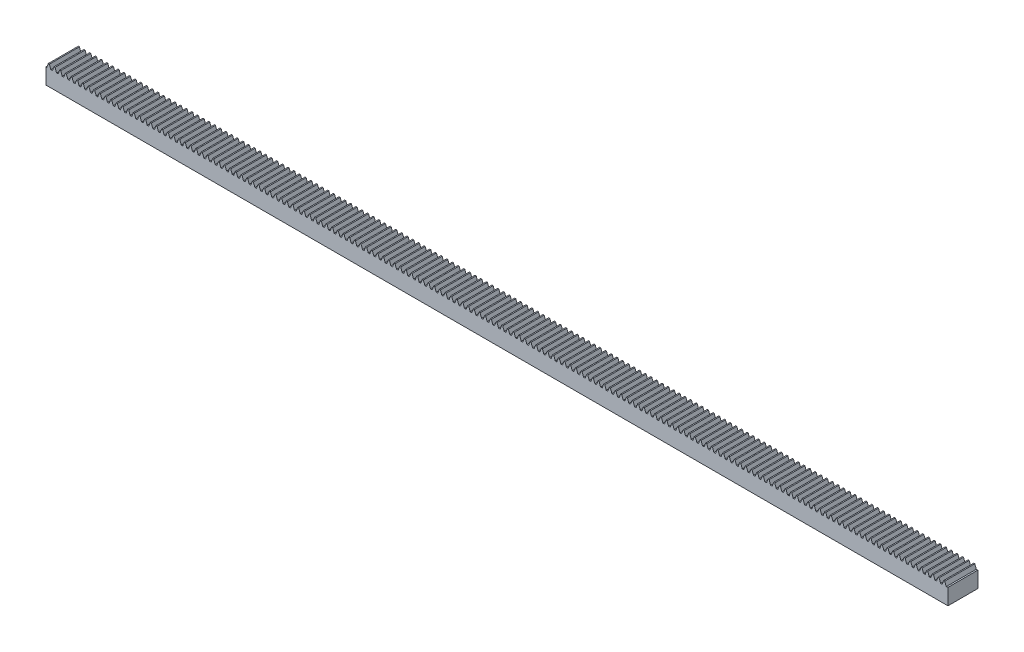
from build123d import *

# Parameters (mm, degrees)
BLANKSKE_W        = 300
BLANKSKE_H        = 6.6
BLANK_DEPTH       = 10
TOOTHCUTSIM_DEPTH = 301.239171328
TEETHCUTS_COUNT   = 161
TEETHCUTS_PITCH   = 1.88495559


with BuildPart() as part:
    # BlankSke → Blank (new body)
    with BuildSketch(Plane.XY):
        with Locations((150, 3.3)):
            Rectangle(BLANKSKE_W, BLANKSKE_H)
    extrude(amount=-BLANK_DEPTH)

    # TooCutSkeSim → ToothCutSim (cut, through all)
    with BuildSketch(Plane.XY):
        Polygon((0.267261222, 5.25), (-0.267261222, 5.25), (-0.767865882, 6.6254), (0.767865882, 6.6254), align=None)
    toothcutsim = extrude(amount=-TOOTHCUTSIM_DEPTH, mode=Mode.SUBTRACT)

    # TeethCuts: ToothCutSim ×161
    with Locations(*[(i * TEETHCUTS_PITCH, 0, 0) for i in range(1, TEETHCUTS_COUNT)]):
        add(toothcutsim, mode=Mode.SUBTRACT)


solid = part.part
